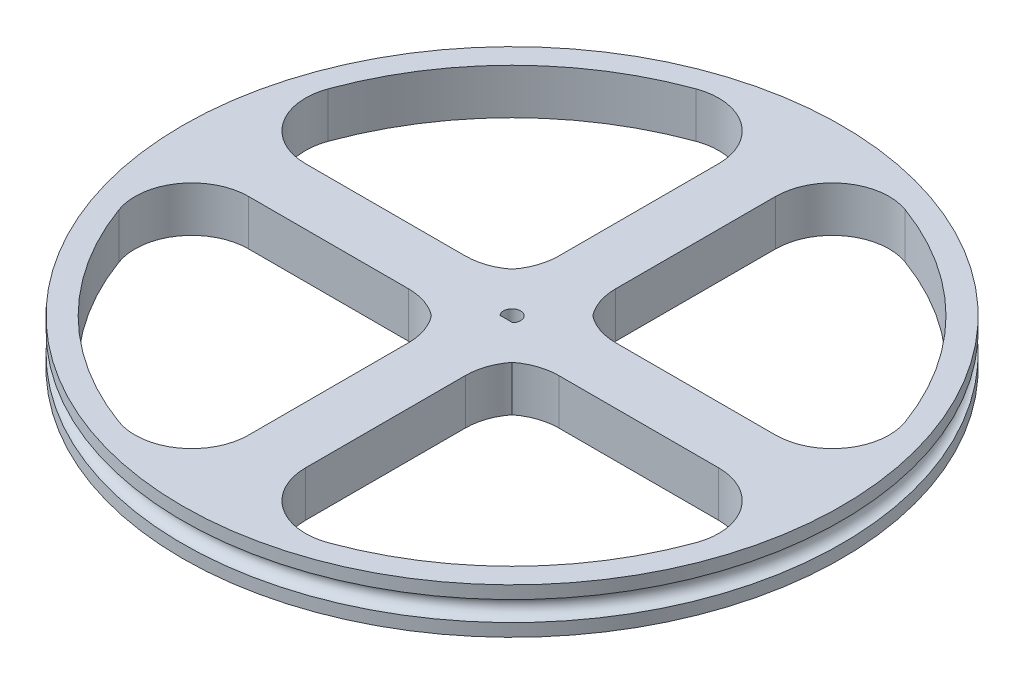
from build123d import *

# Parameters (mm, degrees)
SKETCH_1_R          = 58
EXTRUDE_1_DEPTH     = 8
FILLET_1_R          = 10
FILLET_2_R          = 10
SKETCH_6_R          = 1.7526
CUT_EXTRUDE_1_DEPTH = 20


with BuildPart() as part:
    # 草图1 → 凸台-拉伸1 (new body)
    with BuildSketch(Plane(origin=(0, 0, 0), x_dir=(1, 0, 0), z_dir=(0, 1, 0))):
        with Locations(Location((0, 0, 0), (0, 0, 270))):
            Circle(SKETCH_1_R)
        with BuildLine():
            Line((-5, 53.768020235), (-5, 8.660254038))
            ThreePointArc((-5, 8.660254038), (-7.071067812, 7.071067812), (-8.660254038, 5))
            Line((-8.660254038, 5), (-53.768020235, 5))
            ThreePointArc((-53.768020235, 5), (-38.183766184, 38.183766184), (-5, 53.768020235))
        make_face(mode=Mode.SUBTRACT)
        with BuildLine():
            Line((-53.768020235, -5), (-8.660254038, -5))
            ThreePointArc((-8.660254038, -5), (-7.071067812, -7.071067812), (-5, -8.660254038))
            Line((-5, -8.660254038), (-5, -53.768020235))
            ThreePointArc((-5, -53.768020235), (-38.183766184, -38.183766184), (-53.768020235, -5))
        make_face(mode=Mode.SUBTRACT)
        with BuildLine():
            Line((5, -53.768020235), (5, -8.660254038))
            ThreePointArc((5, -8.660254038), (7.071067812, -7.071067812), (8.660254038, -5))
            Line((8.660254038, -5), (53.768020235, -5))
            ThreePointArc((53.768020235, -5), (38.183766184, -38.183766184), (5, -53.768020235))
        make_face(mode=Mode.SUBTRACT)
        with BuildLine():
            Line((53.768020235, 5), (8.660254038, 5))
            ThreePointArc((8.660254038, 5), (7.071067812, 7.071067812), (5, 8.660254038))
            Line((5, 8.660254038), (5, 53.768020235))
            ThreePointArc((5, 53.768020235), (38.183766184, 38.183766184), (53.768020235, 5))
        make_face(mode=Mode.SUBTRACT)
    extrude(amount=EXTRUDE_1_DEPTH)

    # 圆角1
    fillet_1_edges = [part.edges().sort_by_distance(p)[0] for p in [
        (53.768020235, 4, 5),
        (5, 4, 53.768020235),
        (53.768020235, 4, -5),
        (5, 4, -53.768020235),
        (-5, 4, -53.768020235),
        (-53.768020235, 4, -5),
        (-53.768020235, 4, 5),
        (-5, 4, 53.768020235),
    ]]
    fillet(fillet_1_edges, radius=FILLET_1_R)

    # 圆角2
    # the kernel refuses this fillet: 10 mm, written as the material it adds along each edge
    with BuildSketch(Plane(origin=(5, 0, -8.660254038), x_dir=(0, 0, -1), z_dir=(0, 1, 0)), Plane(origin=(-5, 0, 8.660254038), x_dir=(0, 0, 1), z_dir=(0, 1, 0)), Plane(origin=(-8.660254038, 0, -5), x_dir=(-1, 0, 0), z_dir=(0, 1, 0))) as fillet_2_piece_1:
        with BuildLine():
            CenterArc((4.568502517, -10), FILLET_2_R, 90, 41.409622109)
            ThreePointArc((-2.04587576, -2.5), (-0.921320126, -1.33315892), (0, 0))
            Line((0, 0), (4.568502517, 0))
        make_face()
    extrude(amount=8)
    with BuildSketch(Plane(origin=(8.660254038, 0, -5), x_dir=(1, 0, 0), z_dir=(0, 1, 0)), Plane(origin=(5, 0, 8.660254038), x_dir=(0, 0, 1), z_dir=(0, 1, 0)), Plane(origin=(-8.660254038, 0, 5), x_dir=(-1, 0, 0), z_dir=(0, 1, 0)), Plane(origin=(-5, 0, -8.660254038), x_dir=(0, 0, -1), z_dir=(0, 1, 0))) as fillet_2_piece_2:
        with BuildLine():
            CenterArc((4.568502517, 10), FILLET_2_R, 228.590377891, 41.409622109)
            ThreePointArc((-2.04587576, 2.5), (-0.921320126, 1.33315892), (0, 0))
            Line((0, 0), (4.568502517, 0))
        make_face()
    extrude(amount=8)
    with BuildSketch(Plane(origin=(8.660254038, 0, 5), x_dir=(-0.6333158920043416, 0, 0.7738933911946432), z_dir=(0, 1, 0))) as fillet_2_piece_3:
        with BuildLine():
            CenterArc((4.845628665, 9.868692826), FILLET_2_R, 219.295188945, 41.409622109)
            Line((-2.893305247, 3.535533906), (0, 0))
            ThreePointArc((0, 0), (1.615209555, 0.131307174), (3.23041911, 0))
        make_face()
    extrude(amount=8)

    # 切除-扫描1: sweep along a path in 草图5
    with BuildLine(Plane(origin=(0, 4, 0), x_dir=(1, 0, 0), z_dir=(0, 1, 0))) as sweep_1_path:
        CenterArc((0, 0), 58, 0, 360)
    # 草图6 → 切除-扫描1 (sweep, cut)
    with BuildSketch(Plane.XY):
        with Locations((-58, 4)):
            Circle(SKETCH_6_R)
    sweep(path=sweep_1_path.line, mode=Mode.SUBTRACT)

    # 草图7 → 切除-拉伸1 (cut)
    with BuildSketch(Plane(origin=(0, 0, 0), x_dir=(-1, 0, 0), z_dir=(0, -1, 0))):
        with BuildLine():
            Line((-1.118033989, -1), (-0.213422781, -1))
            Line((-0.213422781, -1), (1.118033989, -1))
            ThreePointArc((1.118033989, -1), (1.401258538, -0.535233135), (1.5, 0))
            ThreePointArc((1.5, 0), (-0.535233135, 1.401258538), (-1.118033989, -1))
        make_face()
    extrude(amount=-CUT_EXTRUDE_1_DEPTH, mode=Mode.SUBTRACT)


solid = part.part
